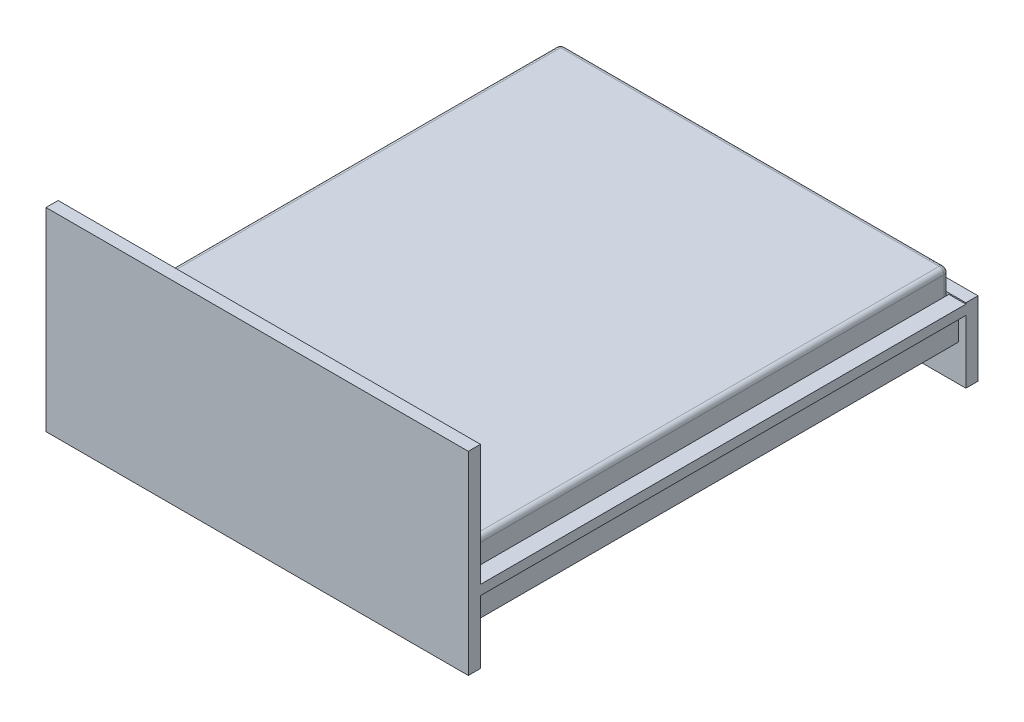
from build123d import *

# Parameters (mm, degrees)
BEDSKETCH_W                        = 50
BEDSKETCH_H                        = 800
BEDHEADERSBOSS_EXTRUDE_DEPTH       = 1740
BEDSKETCH_H_2                      = 305
BEDHEADERSBOSS_EXTRUDE_2_DEPTH     = 1740
BEAMEXTRUDE_THIN_START             = -30
BEDSKETCH_7_W                      = 2000
BEDSKETCH_7_H                      = 150
BEAMEXTRUDE_THIN_DEPTH             = 40
BEDSKETCH_8_W                      = 2000
BEDSKETCH_8_H                      = 40
BEAMTOPEXTRUDE_THIN_DEPTH          = 40
SLATESUPPORTEXTRUDE_THIN_START     = -95
SLATESUPPORTEXTRUDE_THIN_OUTLINE_W = 2000
SLATESUPPORTEXTRUDE_THIN_OUTLINE_H = 25
SLATESUPPORTEXTRUDE_THIN_DEPTH     = 25
SLATESBOSS_EXTRUDE_START           = -70
BEDSKETCH_11_W                     = 102.631578947
BEDSKETCH_11_H                     = 25
SLATESBOSS_EXTRUDE_DEPTH           = 1600
MATTRESSSKETCH_W                   = 2000
MATTRESSSKETCH_H                   = 200
MATTRESSBOSS_EXTRUDE_DEPTH         = 1600
MATTRESSFILLET_R                   = 20


# Read off the part's stored shape, not the designer's step: SlateSupportExtrude-Thin
with BuildPart() as part:
    # BedSketch → BedHeadersBoss-Extrude (new body)
    with BuildSketch(Plane(origin=(0, 0, 0), x_dir=(0, 0, -1), z_dir=(1, 0, 0))):
        with Locations((25, 400)):
            Rectangle(BEDSKETCH_W, BEDSKETCH_H)
    extrude(amount=-BEDHEADERSBOSS_EXTRUDE_DEPTH)



with BuildPart() as body_2:
    # BedSketch → BedHeadersBoss-Extrude 2 (new body)
    with BuildSketch(Plane(origin=(0, 0, 0), x_dir=(0, 0, -1), z_dir=(1, 0, 0))):
        with Locations((2075, 152.5)):
            Rectangle(BEDSKETCH_W, BEDSKETCH_H_2)
    extrude(amount=-BEDHEADERSBOSS_EXTRUDE_2_DEPTH)


with BuildPart() as body_3:
    # BedSketch<7> → BeamExtrude-Thin (new body)
    with BuildSketch(Plane(origin=(0, 0, 0), x_dir=(0, 0, -1), z_dir=(1, 0, 0)).offset(BEAMEXTRUDE_THIN_START)):
        with Locations((1050, 225)):
            Rectangle(BEDSKETCH_7_W, BEDSKETCH_7_H)
    extrude(amount=-BEAMEXTRUDE_THIN_DEPTH)

    # BedSketch<8> → BeamTopExtrude-Thin (add)
    with BuildSketch(Plane(origin=(0, 0, 0), x_dir=(0, 0, -1), z_dir=(1, 0, 0))):
        with Locations((1050, 280)):
            Rectangle(BEDSKETCH_8_W, BEDSKETCH_8_H)
    extrude(amount=-BEAMTOPEXTRUDE_THIN_DEPTH)


with BuildPart() as part_1:
    add(part.part)

    add(body_2.part)  # SlateSupportExtrude-Thin merges body 2

    add(body_3.part)  # SlateSupportExtrude-Thin merges body 3
    # SlateSupportExtrude-Thin outline → SlateSupportExtrude-Thin (add)
    with BuildSketch(Plane(origin=(0, 0, 0), x_dir=(0, 0, -1), z_dir=(1, 0, 0)).offset(SLATESUPPORTEXTRUDE_THIN_START)):
        with Locations((1050, 162.5)):
            Rectangle(SLATESUPPORTEXTRUDE_THIN_OUTLINE_W, SLATESUPPORTEXTRUDE_THIN_OUTLINE_H)
    extrude(amount=SLATESUPPORTEXTRUDE_THIN_DEPTH)

    # BeamMirror: part across plane


with BuildPart() as part_2:
    add(part_1.part)
    add(part_1.part.mirror(Plane(origin=(-870, 0, 0), x_dir=(0, 0, 1), z_dir=(1, 0, 0))))

    # BedSketch<11> → SlatesBoss-Extrude (add)
    with BuildSketch(Plane(origin=(0, 0, 0), x_dir=(0, 0, -1), z_dir=(1, 0, 0)).offset(SLATESBOSS_EXTRUDE_START)):
        with Locations((151.315789473, 187.5)):
            Rectangle(BEDSKETCH_11_W, BEDSKETCH_11_H)
        Polygon((305.263157895, 200), (305.263157895, 175), (407.894736842, 175), (407.894736842, 200), (357.894736842, 200), align=None)
        Polygon((510.526315789, 200), (510.526315789, 175), (613.157894737, 175), (613.157894737, 200), (563.157894737, 200), align=None)
        Polygon((715.789473684, 200), (715.789473684, 175), (818.421052632, 175), (818.421052632, 200), (768.421052632, 200), align=None)
        Polygon((921.052631579, 200), (921.052631579, 175), (1023.684210526, 175), (1023.684210526, 200), (973.684210526, 200), align=None)
        Polygon((1126.315789474, 200), (1126.315789474, 175), (1228.947368421, 175), (1228.947368421, 200), (1178.947368421, 200), align=None)
        Polygon((1331.578947368, 175), (1434.210526316, 175), (1434.210526316, 200), (1384.210526316, 200), (1331.578947368, 200), align=None)
        Polygon((1536.842105263, 175), (1639.473684211, 175), (1639.473684211, 200), (1589.473684211, 200), (1536.842105263, 200), align=None)
        Polygon((1742.105263158, 175), (1844.736842105, 175), (1844.736842105, 200), (1794.736842105, 200), (1742.105263158, 200), align=None)
        Polygon((2050, 175), (2050, 200), (2000, 200), (1947.368421053, 200), (1947.368421053, 175), align=None)
    extrude(amount=-SLATESBOSS_EXTRUDE_DEPTH)


with BuildPart() as body_2_2:
    # MattressSketch → MattressBoss-Extrude (new body)
    with BuildSketch(Plane.ZY.offset(70)):
        with Locations((-1050, 300)):
            Rectangle(MATTRESSSKETCH_W, MATTRESSSKETCH_H)
    extrude(amount=MATTRESSBOSS_EXTRUDE_DEPTH)

    # MattressFillet
    mattressfillet_edges = [body_2_2.edges().sort_by_distance(p)[0] for p in [
        (-1670, 300, -50),
        (-1670, 400, -1050),
        (-1670, 300, -2050),
        (-70, 400, -1050),
        (-70, 300, -50),
        (-70, 200, -1050),
        (-70, 300, -2050),
        (-1670, 200, -1050),
        (-870, 400, -2050),
        (-870, 400, -50),
        (-870, 200, -50),
        (-870, 200, -2050),
    ]]
    fillet(mattressfillet_edges, radius=MATTRESSFILLET_R)


solid = Compound([part_2.part, body_2_2.part])
